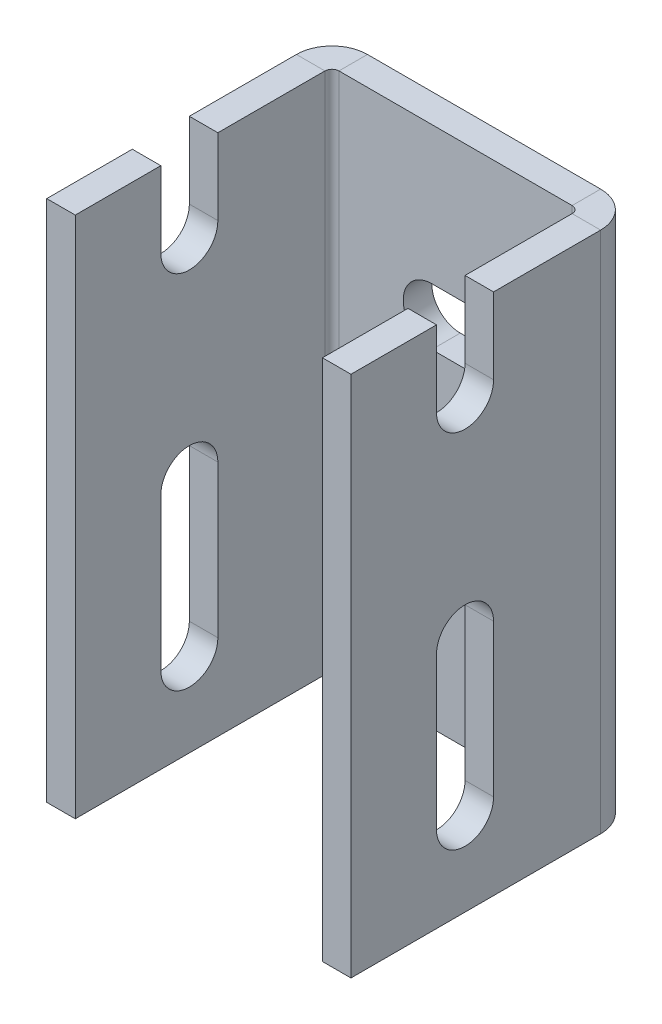
from build123d import *

# Parameters (mm, degrees)
SKETCH1_W                      = 32
SKETCH1_H                      = 55
BASE_FLANGE1_DEPTH             = 3
EDGE_FLANGE1_STRIP_W           = 13.4732
EDGE_FLANGE1_STRIP_H           = 3
EDGE_FLANGE1_STRIP_CUT_DEPTH   = 55
EDGE_FLANGE1_STRIP_2_W         = 13.4732
EDGE_FLANGE1_STRIP_2_H         = 3
EDGE_FLANGE1_STRIP_CUT_2_DEPTH = 55
EDGE_FLANGE1_DEPTH             = 55
EDGE_FLANGE1_BEND_DEPTH        = 55
CUT_EXTRUDE1_DEPTH             = 70.123078635
CUT_EXTRUDE2_DEPTH             = 70.123078635


# Sheet-metal steps are written as plain solids
with BuildPart() as part:
    # Sketch1 → Base-Flange1 (new body)
    with BuildSketch(Plane.XY):
        with Locations((16, 27.5)):
            Rectangle(SKETCH1_W, SKETCH1_H)
    extrude(amount=-BASE_FLANGE1_DEPTH)

    # Edge-Flange1 strip (across the edge) → Edge-Flange1 strip cut (cut)
    with BuildSketch(Plane(origin=(32, 0, 0), x_dir=(-1, 0, 0), z_dir=(0, 1, 0))):
        with Locations((-3, -1.5)):
            Rectangle(EDGE_FLANGE1_STRIP_W, EDGE_FLANGE1_STRIP_H)
    extrude(amount=EDGE_FLANGE1_STRIP_CUT_DEPTH, mode=Mode.SUBTRACT)

    # Edge-Flange1 strip 2 (across the edge) → Edge-Flange1 strip cut 2 (cut)
    with BuildSketch(Plane.XZ.offset(-55)):
        with Locations((-3, -1.5)):
            Rectangle(EDGE_FLANGE1_STRIP_2_W, EDGE_FLANGE1_STRIP_2_H)
    extrude(amount=EDGE_FLANGE1_STRIP_CUT_2_DEPTH, mode=Mode.SUBTRACT)

    # Edge-Flange1 section (across the edge) → Edge-Flange1 (add)
    with BuildSketch(Plane(origin=(32, 0, 0), x_dir=(-1, 0, 0), z_dir=(0, 1, 0))):
        with BuildLine():
            Line((0, 0.7366), (0, 27))
            Line((0, 27), (3, 27))
            Line((3, 27), (3, 0.7366))
            ThreePointArc((3, 0.7366), (3.215745145, 0.215745145), (3.7366, 0))
            Line((3.7366, 0), (3.7366, -3))
            ThreePointArc((3.7366, -3), (1.094424801, -1.905575199), (0, 0.7366))
        make_face()
    extrude(amount=EDGE_FLANGE1_DEPTH)

    # Edge-Flange1 section 2 (across the edge) → Edge-Flange1 bend (add)
    with BuildSketch(Plane.XZ.offset(-55)):
        with BuildLine():
            Line((0, 0.7366), (0, 27))
            Line((0, 27), (3, 27))
            Line((3, 27), (3, 0.7366))
            ThreePointArc((3, 0.7366), (3.215745145, 0.215745145), (3.7366, 0))
            Line((3.7366, 0), (3.7366, -3))
            ThreePointArc((3.7366, -3), (1.094424801, -1.905575199), (0, 0.7366))
        make_face()
    extrude(amount=EDGE_FLANGE1_BEND_DEPTH)

    # Sketch12 → Cut-Extrude1 (cut, through all)
    with BuildSketch(Plane.XY):
        with BuildLine():
            Line((13.5, 40.5), (18.5, 40.5))
            ThreePointArc((18.5, 40.5), (21.5, 37.5), (18.5, 34.5))
            Line((18.5, 34.5), (13.5, 34.5))
            ThreePointArc((13.5, 34.5), (10.5, 37.5), (13.5, 40.5))
        make_face()
        with BuildLine():
            Line((13.5, 20.5), (18.5, 20.5))
            ThreePointArc((18.5, 20.5), (21.5, 17.5), (18.5, 14.5))
            Line((18.5, 14.5), (13.5, 14.5))
            ThreePointArc((13.5, 14.5), (10.5, 17.5), (13.5, 20.5))
        make_face()
    extrude(amount=-CUT_EXTRUDE1_DEPTH, mode=Mode.SUBTRACT)

    # Sketch13 → Cut-Extrude2 (cut, through all)
    with BuildSketch(Plane(origin=(32, 0, 0), x_dir=(0, 0, -1), z_dir=(1, 0, 0))):
        with BuildLine():
            Line((-12, 55), (-12, 47))
            ThreePointArc((-12, 47), (-15, 44), (-18, 47))
            Line((-18, 47), (-18, 55))
            ThreePointArc((-18, 55), (-15, 58), (-12, 55))
        make_face()
        with BuildLine():
            Line((-12, 25), (-12, 9))
            ThreePointArc((-12, 9), (-15, 6), (-18, 9))
            Line((-18, 9), (-18, 25))
            ThreePointArc((-18, 25), (-15, 28), (-12, 25))
        make_face()
    extrude(amount=-CUT_EXTRUDE2_DEPTH, mode=Mode.SUBTRACT)


solid = part.part
